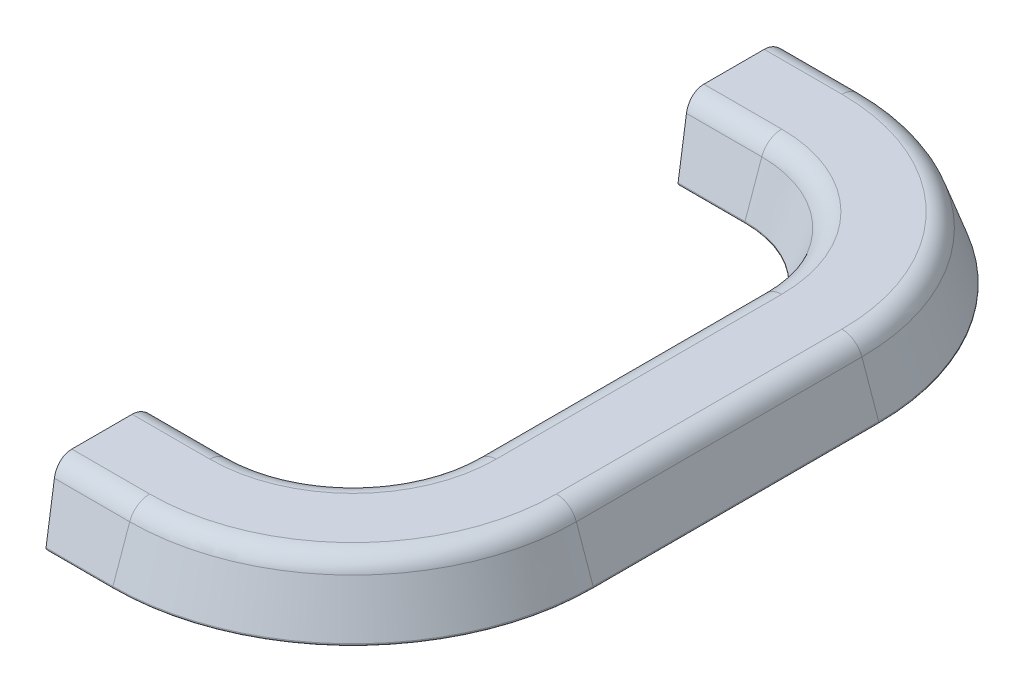
from build123d import *

# Parameters (mm, degrees)
FILLET1_R      = 5.08
SHELL1_T       = -2.54
EXTRUDE1_REACH = 121.17
FILLET2_R      = 0.396875


with BuildPart() as part:
    # Sweep1: sweep along a path in Sketch2
    with BuildLine(Plane(origin=(0, 0, 0), x_dir=(1, 0, 0), z_dir=(0, 1, 0))) as sweep1_path:
        Line((0, -59.724007387), (18.701415201, -59.724007387))
        ThreePointArc((18.701415201, -59.724007387), (36.661927443, -52.284519629), (44.101415201, -34.324007387))
        Line((44.101415201, -34.324007387), (44.101415201, 34.324007387))
        ThreePointArc((44.101415201, 34.324007387), (36.661927443, 52.284519629), (18.701415201, 59.724007387))
        Line((18.701415201, 59.724007387), (0, 59.724007387))
    # Sketch1 → Sweep1 (sweep)
    with BuildSketch(Plane(origin=(0, 0, 0), x_dir=(0, 0, -1), z_dir=(1, 0, 0))):
        Polygon((-92.230378578, 0), (-59.724007387, 0), (-65.134510769, 15.350234506), (-86.819875195, 15.350234506), align=None)
    sweep(path=sweep1_path.line)

    # SurfaceCut1
    split(bisect_by=Plane(origin=(2.625044703, 0.462866207, 0), x_dir=(0, 0, 1), z_dir=(-0.9848077530122041, -0.17364817766695276, 0)), keep=Keep.BOTTOM)

    # Fillet1
    fillet1_edges = [part.edges().sort_by_distance(p)[0] for p in [
        (55.821599313, 15.350234506, 71.444191499),
        (40.487731075, 15.350234506, 56.11032326),
        (71.19728301, 15.350234506, 0),
        (49.511918584, 15.350234506, 0),
        (55.821599313, 15.350234506, -71.444191499),
        (40.487731075, 15.350234506, -56.11032326),
        (9.350707601, 15.350234506, -86.819875195),
        (9.350707601, 15.350234506, -65.134510769),
        (9.350707601, 15.350234506, 86.819875195),
        (9.350707601, 15.350234506, 65.134510769),
    ]]
    fillet(fillet1_edges, radius=FILLET1_R)

    # Shell1
    shell1_openings = [part.faces().sort_by_distance(p)[0] for p in [
        (45.698397314, 0, 0),
        (1.458578097, 7.07822706, -75.977192982),
        (1.458578097, 7.07822706, 75.977192982),
    ]]
    offset(amount=SHELL1_T, openings=shell1_openings, kind=Kind.INTERSECTION)

    # Sketch4 → Extrude1 (add, up to next)
    with BuildSketch(Plane(origin=(2.625044703, 0.462866207, 0), x_dir=(0, 0, 1), z_dir=(-0.9848077530122041, -0.1736481776669528, 0)), mode=Mode.PRIVATE) as extrude1_sk1:
        with BuildLine():
            Line((-78.948196177, 12.537846358), (-78.59959728, 8.553342733))
            ThreePointArc((-78.59959728, 8.553342733), (-75.977192982, 6.150351924), (-73.354788685, 8.553342733))
            Line((-73.354788685, 8.553342733), (-73.006189788, 12.537846358))
            Line((-73.006189788, 12.537846358), (-78.948196177, 12.537846358))
        make_face()
    extrude1_tool1 = extrude(extrude1_sk1.sketch, amount=-EXTRUDE1_REACH, mode=Mode.PRIVATE) - part.part
    extrude1 = extrude1_tool1.solids().sort_by_distance((0.946808, 9.980618, -75.977193))[0]
    add(extrude1)

    # Sketch5 → 7/64 (0.10938) Diameter Hole1 (revolve, cut)
    with BuildSketch(Plane(origin=(1.099932111, 9.112209524, -75.977192982), x_dir=(0.1736481776669528, -0.9848077530122041, 0), z_dir=(0, 0, 1))):
        Polygon((0, 0), (0, 13.534671108), (1.389126, 12.7), (1.389126, 0), align=None)
    f_7_64_0_10938_diameter_hole1 = revolve(axis=Axis((-5.153597121, 8.009543596, -75.977192982), (0.9848077530122041, 0.1736481776669528, 0)), mode=Mode.SUBTRACT)

    # Mirror1: Extrude1, 7/64 (0.10938) Diameter Hole1 across plane
    add(extrude1.mirror(Plane.XY))
    add(f_7_64_0_10938_diameter_hole1.mirror(Plane.XY), mode=Mode.SUBTRACT)

    # Fillet2
    fillet2_edges = [part.edges().sort_by_distance(p)[0] for p in [
        (36.661927443, 0, 52.284519629),
        (59.647402944, 0, 75.26999513),
        (11.920791464, 12.810234506, -78.773896729),
        (11.920791464, 12.810234506, -73.180489236),
        (37.231090066, 12.810234506, -76.005795341),
        (11.920791464, 12.810234506, 78.773896729),
        (37.231090066, 12.810234506, 76.005795341),
        (11.920791464, 12.810234506, 73.180489236),
        (44.101415201, 0, 0),
        (76.607786392, 0, 0),
        (36.661927443, 0, -52.284519629),
        (59.647402944, 0, -75.26999513),
        (10.704037852, 0, -59.724007387),
        (10.704037852, 0, -92.230378578),
        (10.704037852, 0, 59.724007387),
        (10.704037852, 0, 92.230378578),
    ]]
    fillet(fillet2_edges, radius=FILLET2_R)


solid = part.part
